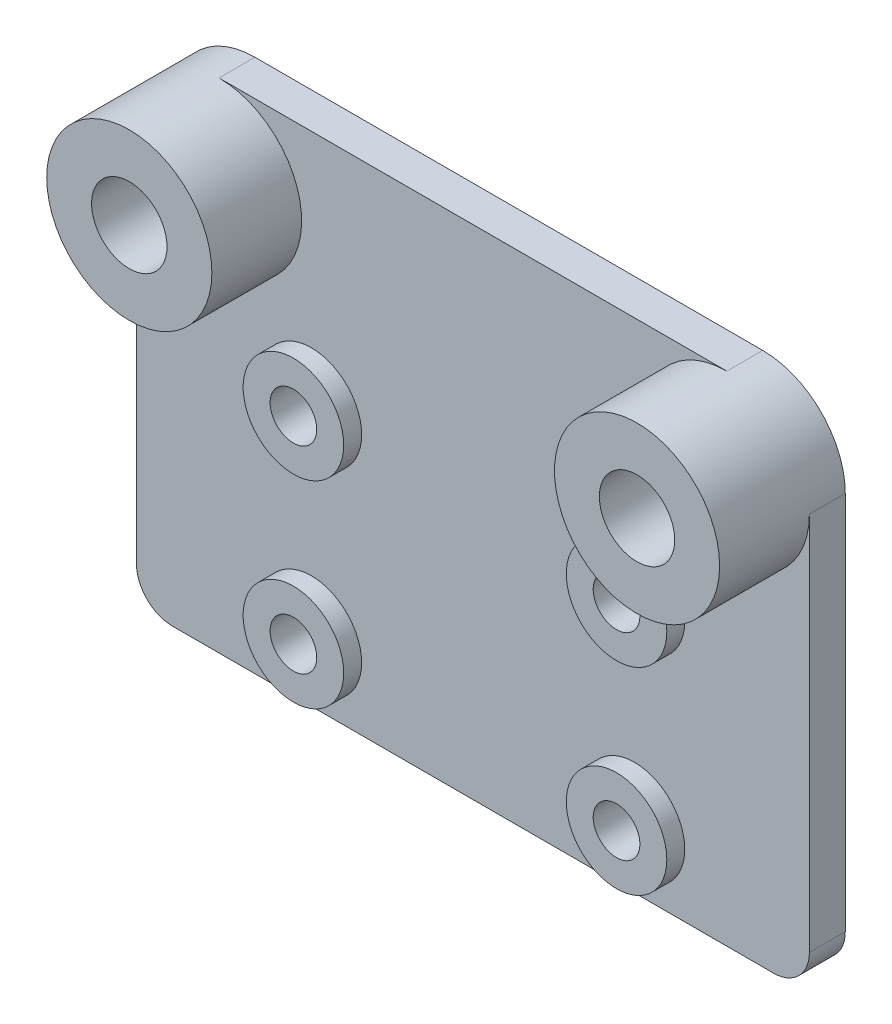
from build123d import *

# Parameters (mm, degrees)
ESQUISSE1_R             = 25
ESQUISSE1_R_2           = 2.1
ESQUISSE1_R_3           = 1.3
BOSS_EXTRU_1_DEPTH      = 2
ESQUISSE2_W             = 22
ESQUISSE2_H             = 10
ENL_V_MAT_EXTRU_1_DEPTH = 2
ESQUISSE3_R             = 2.8
ESQUISSE3_R_2           = 1.3
ESQUISSE3_R_3           = 4.6
ESQUISSE3_R_4           = 2.1
ESQUISSE3_R_5           = 3.6
BOSS_EXTRU_2_DEPTH      = 1
ESQUISSE4_OUTSIDE_W     = 66.154
ESQUISSE4_OUTSIDE_H     = 66.154
ENL_V_MAT_EXTRU_2_DEPTH = 36.482389998
CONG_1_R                = 2
ESQUISSE5_R             = 4.6
ESQUISSE5_R_2           = 2.1
BOSS_EXTRU_3_DEPTH      = 4


with BuildPart() as part:
    # Esquisse1 → Boss.-Extru.1 (new body)
    with BuildSketch(Plane.XY):
        Circle(ESQUISSE1_R)
        with Locations((-14.142135624, 14.142135624)):
            Circle(ESQUISSE1_R_2, mode=Mode.SUBTRACT)
        with Locations((14.142135624, 14.142135624)):
            Circle(ESQUISSE1_R_2, mode=Mode.SUBTRACT)
        with Locations((-9, 5.5)):
            Circle(ESQUISSE1_R_3, mode=Mode.SUBTRACT)
        with Locations((-9, -5.5)):
            Circle(ESQUISSE1_R_3, mode=Mode.SUBTRACT)
        with Locations((9, 5.5)):
            Circle(ESQUISSE1_R_3, mode=Mode.SUBTRACT)
        with Locations((9, -5.5)):
            Circle(ESQUISSE1_R_3, mode=Mode.SUBTRACT)
    extrude(amount=BOSS_EXTRU_1_DEPTH)

    # Esquisse2 → Enlèv. mat.-Extru.1 (cut)
    with BuildSketch(Plane.XY.offset(2)):
        with Locations((0, -14)):
            Rectangle(ESQUISSE2_W, ESQUISSE2_H)
    extrude(amount=-ENL_V_MAT_EXTRU_1_DEPTH, mode=Mode.SUBTRACT)

    # Esquisse3 → Boss.-Extru.2 (add)
    # profile 1 of 8: a face of its own
    with BuildSketch(Plane.XY.offset(2)):
        with Locations((-9, -5.5)):
            Circle(ESQUISSE3_R)
        with Locations((-9, -5.5)):
            Circle(ESQUISSE3_R_2, mode=Mode.SUBTRACT)
    # profile 2 of 8: a face of its own
    with BuildSketch(Plane.XY.offset(2)):
        with Locations((9, -5.5)):
            Circle(ESQUISSE3_R)
        with Locations((9, -5.5)):
            Circle(ESQUISSE3_R_2, mode=Mode.SUBTRACT)
    # profile 3 of 8: a face of its own
    with BuildSketch(Plane.XY.offset(2)):
        with Locations((9, 5.5)):
            Circle(ESQUISSE3_R)
        with Locations((9, 5.5)):
            Circle(ESQUISSE3_R_2, mode=Mode.SUBTRACT)
    # profile 4 of 8: a face of its own
    with BuildSketch(Plane.XY.offset(2)):
        with Locations((-9, 5.5)):
            Circle(ESQUISSE3_R)
        with Locations((-9, 5.5)):
            Circle(ESQUISSE3_R_2, mode=Mode.SUBTRACT)
    # profile 5 of 8: a face of its own
    with BuildSketch(Plane.XY.offset(2)):
        with Locations((-14.142135624, 14.142135624)):
            Circle(ESQUISSE3_R_3)
        with Locations((-14.142135624, 14.142135624)):
            Circle(ESQUISSE3_R_4, mode=Mode.SUBTRACT)
    # profile 6 of 8: a face of its own
    with BuildSketch(Plane.XY.offset(2)):
        with Locations((14.142135624, -14.142135624)):
            Circle(ESQUISSE3_R_5)
        with Locations((14.142135624, -14.142135624)):
            Circle(ESQUISSE3_R_4, mode=Mode.SUBTRACT)
    # profile 7 of 8: a face of its own
    with BuildSketch(Plane.XY.offset(2)):
        with Locations((-14.142135624, -14.142135624)):
            Circle(ESQUISSE3_R_5)
        with Locations((-14.142135624, -14.142135624)):
            Circle(ESQUISSE3_R_4, mode=Mode.SUBTRACT)
    # profile 8 of 8: a face of its own
    with BuildSketch(Plane.XY.offset(2)):
        with Locations((14.142135624, 14.142135624)):
            Circle(ESQUISSE3_R_3)
        with Locations((14.142135624, 14.142135624)):
            Circle(ESQUISSE3_R_4, mode=Mode.SUBTRACT)
    extrude(amount=BOSS_EXTRU_2_DEPTH)

    # Esquisse4 outside → Enlèv. mat.-Extru.2 (cut, through all)
    with BuildSketch(Plane(origin=(0, 0, 0), x_dir=(-1, 0, 0), z_dir=(0, 0, -1))):
        Rectangle(ESQUISSE4_OUTSIDE_W, ESQUISSE4_OUTSIDE_H)
        with BuildLine():
            Line((-14.142135624, 18.742135624), (14.142135624, 18.742135624))
            ThreePointArc((14.142135624, 18.742135624), (17.394826817, 17.394826817), (18.742135624, 14.142135624))
            Line((18.742135624, 14.142135624), (18.742135624, -9))
            Line((18.742135624, -9), (-18.742135624, -9))
            Line((-18.742135624, -9), (-18.742135624, 14.142135624))
            ThreePointArc((-18.742135624, 14.142135624), (-17.394826817, 17.394826817), (-14.142135624, 18.742135624))
        make_face(mode=Mode.SUBTRACT)
    extrude(amount=-ENL_V_MAT_EXTRU_2_DEPTH, mode=Mode.SUBTRACT)

    # Congé1
    cong_1_edges = [part.edges().sort_by_distance(p)[0] for p in [
        (18.742135624, -9, 1),
        (-18.742135624, -9, 1),
    ]]
    fillet(cong_1_edges, radius=CONG_1_R)

    # Esquisse5 → Boss.-Extru.3 (add)
    # profile 1 of 2: a face of its own
    with BuildSketch(Plane.XY.offset(3)):
        with Locations((14.142135624, 14.142135624)):
            Circle(ESQUISSE5_R)
        with Locations((14.142135624, 14.142135624)):
            Circle(ESQUISSE5_R_2, mode=Mode.SUBTRACT)
    # profile 2 of 2: a face of its own
    with BuildSketch(Plane.XY.offset(3)):
        with Locations((-14.142135624, 14.142135624)):
            Circle(ESQUISSE5_R)
        with Locations((-14.142135624, 14.142135624)):
            Circle(ESQUISSE5_R_2, mode=Mode.SUBTRACT)
    extrude(amount=BOSS_EXTRU_3_DEPTH)


solid = part.part
